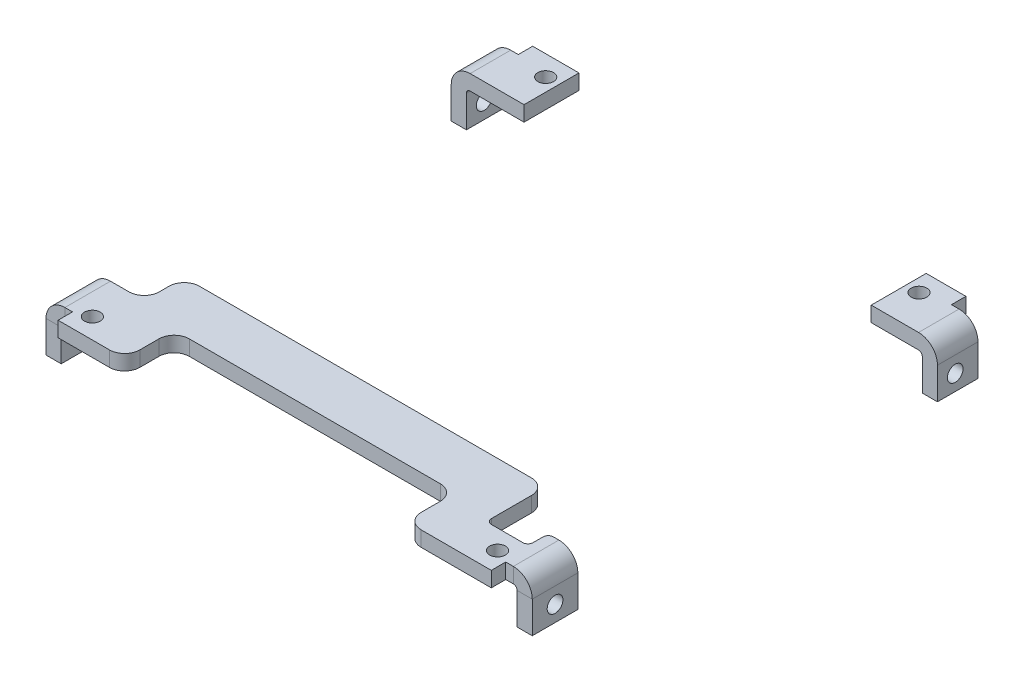
from build123d import *

# Parameters (mm, degrees)
SKETCH2_R                = 1.55
SKETCH2_W                = 53.846
SKETCH2_H                = 54.164
BASE_FLANGE1_DEPTH       = 3
VARFILLET1_START         = -3
VARFILLET1_DEPTH         = 3
VARFILLET2_START         = -3
VARFILLET2_DEPTH         = 3
EDGE_FLANGE1_START       = -44
EDGE_FLANGE1_DEPTH       = 88
EDGE_FLANGE1_START_2     = -45.5
EDGE_FLANGE1_2_OUTLINE_W = 1.2366
EDGE_FLANGE1_2_OUTLINE_H = 3
EDGE_FLANGE1_2_DEPTH     = 1.5
EDGE_FLANGE1_START_3     = 44
EDGE_FLANGE1_3_OUTLINE_W = 1.2366
EDGE_FLANGE1_3_OUTLINE_H = 3
EDGE_FLANGE1_3_DEPTH     = 1.5
EDGE_FLANGE1_4_DEPTH     = 9
EDGE_FLANGE1_START_4     = 35
EDGE_FLANGE1_5_DEPTH     = 9
CUT_EXTRUDE1_DEPTH       = 69.614867264
SKETCH20_R               = 1.55
CUT_EXTRUDE2_DEPTH       = 108.288967324
CUT_EXTRUDE3_DEPTH       = 68.815356
CUT_EXTRUDE3_DEPTH_BACK  = 68.815356
FILLET1_R                = 3
CUT_EXTRUDE4_DEPTH       = 68.815356
SKETCH29_W               = 8.227003602
SKETCH29_H               = 15.176745615
CUT_EXTRUDE5_DEPTH       = 68.815356
FILLET2_R                = 1
FILLET3_R                = 3


with BuildPart() as part:
    # Base-Flange1: sheet metal written as solids
    # Sketch2 → Base-Flange1 (new body)
    with BuildSketch(Plane(origin=(0, 0, 0), x_dir=(1, 0, 0), z_dir=(0, 1, 0))):
        Polygon((-29.625, 48), (-29.625, 37.082), (30.923, 37.082), (30.923, 48), (44, 48), (44, 44), (48, 44), (48, 35), (36.923, 35), (36.923, -35), (48, -35), (48, -44), (44, -44), (44, -48), (30.923, -48), (25.923, -48), (25.923, -37.082), (-29.625, -37.082), (-29.625, -48), (-44, -48), (-44, -44), (-48, -44), (-48, -35), (-37.625, -35), (-37.625, 35), (-48, 35), (-48, 44), (-44, 44), (-44, 48), align=None)
        with Locations(Location((-36.2, 42.85, 0), (0, 0, 270))):
            Circle(SKETCH2_R, mode=Mode.SUBTRACT)
        with Locations(Location((-40, -42.85, 0), (0, 0, 270))):
            Circle(SKETCH2_R, mode=Mode.SUBTRACT)
        with Locations(Location((40, -42.85, 0), (0, 0, 270))):
            Circle(SKETCH2_R, mode=Mode.SUBTRACT)
        with Locations(Location((37.5, 42.85, 0), (0, 0, 270))):
            Circle(SKETCH2_R, mode=Mode.SUBTRACT)
        Rectangle(SKETCH2_W, SKETCH2_H, mode=Mode.SUBTRACT)
    extrude(amount=-BASE_FLANGE1_DEPTH)

    # VarFillet1: read off the stored shape, not the designer's step
    # VarFillet1 outline → VarFillet1 (add)
    with BuildSketch(Plane(origin=(0, 0, 0), x_dir=(1, 0, 0), z_dir=(0, 1, 0)).offset(VARFILLET1_START)):
        with BuildLine():
            Line((30.923, 37.082), (30.923, 40.082))
            add(Edge.make_bspline(
                [(30.923, 40.082), (30.923, 37.082), (27.923, 37.082)],
                knots=[0, 0, 0, 1, 1, 1], degree=2, weights=[1, 0.707106781, 1]))
            Line((27.923, 37.082), (30.923, 37.082))
        make_face()
        with BuildLine():
            Line((36.923, 35), (36.923, 32))
            add(Edge.make_bspline(
                [(36.923, 32), (36.923, 35), (39.923, 35)],
                knots=[0, 0, 0, 1, 1, 1], degree=2, weights=[1, 0.707106781, 1]))
            Line((39.923, 35), (36.923, 35))
        make_face()
        with BuildLine():
            add(Edge.make_bspline(
                [(39.923, -35), (36.923, -35), (36.923, -32)],
                knots=[0, 0, 0, 1, 1, 1], degree=2, weights=[1, 0.707106781, 1]))
            Line((36.923, -32), (36.923, -35))
            Line((36.923, -35), (39.923, -35))
        make_face()
        with BuildLine():
            Line((-29.625, -37.082), (-29.625, -40.082))
            add(Edge.make_bspline(
                [(-29.625, -40.082), (-29.625, -37.082), (-26.625, -37.082)],
                knots=[0, 0, 0, 1, 1, 1], degree=2, weights=[1, 0.707106781, 1]))
            Line((-26.625, -37.082), (-29.625, -37.082))
        make_face()
    extrude(amount=VARFILLET1_DEPTH)

    # VarFillet2: read off the stored shape, not the designer's step
    # VarFillet2 outline → VarFillet2 (add)
    with BuildSketch(Plane(origin=(0, 0, 0), x_dir=(1, 0, 0), z_dir=(0, 1, 0)).offset(VARFILLET2_START)):
        with BuildLine():
            Line((26.923, -27.082), (26.923, -24.082))
            add(Edge.make_bspline(
                [(26.923, -24.082), (26.923, -27.082), (23.923, -27.082)],
                knots=[0, 0, 0, 1, 1, 1], degree=2, weights=[1, 0.707106781, 1]))
            Line((23.923, -27.082), (26.923, -27.082))
        make_face()
        with BuildLine():
            add(Edge.make_bspline(
                [(23.923, 27.082), (26.923, 27.082), (26.923, 24.082)],
                knots=[0, 0, 0, 1, 1, 1], degree=2, weights=[1, 0.707106781, 1]))
            Line((26.923, 24.082), (26.923, 27.082))
            Line((26.923, 27.082), (23.923, 27.082))
        make_face()
        with BuildLine():
            Line((-26.923, -27.082), (-23.923, -27.082))
            add(Edge.make_bspline(
                [(-23.923, -27.082), (-26.923, -27.082), (-26.923, -24.082)],
                knots=[0, 0, 0, 1, 1, 1], degree=2, weights=[1, 0.707106781, 1]))
            Line((-26.923, -24.082), (-26.923, -27.082))
        make_face()
        with BuildLine():
            add(Edge.make_bspline(
                [(-26.923, 24.082), (-26.923, 27.082), (-23.923, 27.082)],
                knots=[0, 0, 0, 1, 1, 1], degree=2, weights=[1, 0.707106781, 1]))
            Line((-23.923, 27.082), (-26.923, 27.082))
            Line((-26.923, 27.082), (-26.923, 24.082))
        make_face()
        with BuildLine():
            Line((-37.625, -35), (-37.625, -32))
            add(Edge.make_bspline(
                [(-37.625, -32), (-37.625, -35), (-40.625, -35)],
                knots=[0, 0, 0, 1, 1, 1], degree=2, weights=[1, 0.707106781, 1]))
            Line((-40.625, -35), (-37.625, -35))
        make_face()
        with BuildLine():
            add(Edge.make_bspline(
                [(-40.625, 35), (-37.625, 35), (-37.625, 32)],
                knots=[0, 0, 0, 1, 1, 1], degree=2, weights=[1, 0.707106781, 1]))
            Line((-37.625, 32), (-37.625, 35))
            Line((-37.625, 35), (-40.625, 35))
        make_face()
        with BuildLine():
            Line((-29.625, 37.082), (-26.625, 37.082))
            add(Edge.make_bspline(
                [(-26.625, 37.082), (-29.625, 37.082), (-29.625, 40.082)],
                knots=[0, 0, 0, 1, 1, 1], degree=2, weights=[1, 0.707106781, 1]))
            Line((-29.625, 40.082), (-29.625, 37.082))
        make_face()
    extrude(amount=VARFILLET2_DEPTH)

    # Edge-Flange1: read off the stored shape, not the designer's step
    # Edge-Flange1 outline → Edge-Flange1 (cut)
    with BuildSketch(Plane.XY.offset(EDGE_FLANGE1_START)):
        with BuildLine():
            ThreePointArc((-47.926677222, -3), (-46.630867001, -0.845704021), (-44.2634, 0))
            Line((-44.2634, 0), (-48, 0))
            Line((-48, 0), (-48, -3))
            Line((-48, -3), (-47.926677222, -3))
        make_face()
        with BuildLine():
            Line((48, 0), (44.2634, 0))
            ThreePointArc((44.2634, 0), (46.630867001, -0.845704021), (47.926677222, -3))
            Line((47.926677222, -3), (48, -3))
            Line((48, -3), (48, 0))
        make_face()
    extrude(amount=EDGE_FLANGE1_DEPTH, mode=Mode.SUBTRACT)

    # Edge-Flange1 2 outline → Edge-Flange1 2 (cut)
    with BuildSketch(Plane.XY.offset(EDGE_FLANGE1_START_2)):
        with Locations((-43.3817, -1.5)):
            Rectangle(EDGE_FLANGE1_2_OUTLINE_W, EDGE_FLANGE1_2_OUTLINE_H)
        with Locations((43.3817, -1.5)):
            Rectangle(EDGE_FLANGE1_2_OUTLINE_W, EDGE_FLANGE1_2_OUTLINE_H)
    extrude(amount=EDGE_FLANGE1_2_DEPTH, mode=Mode.SUBTRACT)

    # Edge-Flange1 3 outline → Edge-Flange1 3 (cut)
    with BuildSketch(Plane.XY.offset(EDGE_FLANGE1_START_3)):
        with Locations((-43.3817, -1.5)):
            Rectangle(EDGE_FLANGE1_3_OUTLINE_W, EDGE_FLANGE1_3_OUTLINE_H)
        with Locations((43.3817, -1.5)):
            Rectangle(EDGE_FLANGE1_3_OUTLINE_W, EDGE_FLANGE1_3_OUTLINE_H)
    extrude(amount=EDGE_FLANGE1_3_DEPTH, mode=Mode.SUBTRACT)

    # Edge-Flange1 4 outline → Edge-Flange1 4 (add)
    with BuildSketch(Plane.XY.offset(EDGE_FLANGE1_START)):
        with BuildLine():
            ThreePointArc((-45, -3.7366), (-44.784254855, -3.215745145), (-44.2634, -3))
            Line((-44.2634, -3), (-47.926677222, -3))
            ThreePointArc((-47.926677222, -3), (-47.981624121, -3.36647982), (-48, -3.7366))
            Line((-48, -3.7366), (-48, -10))
            Line((-48, -10), (-45, -10))
            Line((-45, -10), (-45, -3.7366))
        make_face()
        with BuildLine():
            Line((47.926677222, -3), (44.2634, -3))
            ThreePointArc((44.2634, -3), (44.784254855, -3.215745145), (45, -3.7366))
            Line((45, -3.7366), (45, -10))
            Line((45, -10), (48, -10))
            Line((48, -10), (48, -3.7366))
            ThreePointArc((48, -3.7366), (47.981624121, -3.36647982), (47.926677222, -3))
        make_face()
    extrude(amount=EDGE_FLANGE1_4_DEPTH)

    # Edge-Flange1 5 outline → Edge-Flange1 5 (add)
    with BuildSketch(Plane.XY.offset(EDGE_FLANGE1_START_4)):
        with BuildLine():
            ThreePointArc((-45, -3.7366), (-44.784254855, -3.215745145), (-44.2634, -3))
            Line((-44.2634, -3), (-47.926677222, -3))
            ThreePointArc((-47.926677222, -3), (-47.981624121, -3.36647982), (-48, -3.7366))
            Line((-48, -3.7366), (-48, -10))
            Line((-48, -10), (-45, -10))
            Line((-45, -10), (-45, -3.7366))
        make_face()
        with BuildLine():
            Line((47.926677222, -3), (44.2634, -3))
            ThreePointArc((44.2634, -3), (44.784254855, -3.215745145), (45, -3.7366))
            Line((45, -3.7366), (45, -10))
            Line((45, -10), (48, -10))
            Line((48, -10), (48, -3.7366))
            ThreePointArc((48, -3.7366), (47.981624121, -3.36647982), (47.926677222, -3))
        make_face()
    extrude(amount=EDGE_FLANGE1_5_DEPTH)

    # Sketch19 → Cut-Extrude1 (cut, through all)
    with BuildSketch(Plane(origin=(0, 0, 0), x_dir=(1, 0, 0), z_dir=(0, 1, 0))):
        Polygon((-42.7634, 45.5), (-42.7634, 46.85), (-29.625, 46.85), (-29.625, 48), (-44, 48), (-44, 45.5), align=None)
        Polygon((44, 45.5), (42.7634, 45.5), (42.7634, 46.85), (29.625, 46.85), (29.625, 48), (44, 48), align=None)
        Polygon((42.7634, -45.5), (42.7634, -46.85), (24.798845721, -46.85), (24.798845721, -48), (44, -48), (44, -45.5), align=None)
        Polygon((-44, -45.5), (-42.7634, -45.5), (-42.7634, -46.85), (-29.625, -46.85), (-29.625, -48), (-44, -48), align=None)
    extrude(amount=-CUT_EXTRUDE1_DEPTH, mode=Mode.SUBTRACT)

    # Sketch20 → Cut-Extrude2 (cut, through all)
    with BuildSketch(Plane.ZY.offset(48)):
        with Locations(Location((-39.5, -6.8683, 0), (0, 0, 270))):
            Circle(SKETCH20_R)
        with Locations(Location((39.5, -6.8683, 0), (0, 0, 270))):
            Circle(SKETCH20_R)
    extrude(amount=-CUT_EXTRUDE2_DEPTH, mode=Mode.SUBTRACT)

    # Sketch21 → Cut-Extrude3 (cut, two sides: drawn at the far end of the back side and taken through both)
    with BuildSketch(Plane(origin=(0, 0, 0), x_dir=(1, 0, 0), z_dir=(0, 1, 0)).offset(-CUT_EXTRUDE3_DEPTH_BACK)):
        Polygon((36.923, -27.082), (-37.625, -27.082), (-71.217622097, -27.082), (-71.217622097, 35), (-32.625, 35), (-32.625, 50), (33.923, 50), (33.923, 35), (65.560700491, 35), (65.560700491, -21.509199751), align=None)
    extrude(amount=CUT_EXTRUDE3_DEPTH + CUT_EXTRUDE3_DEPTH_BACK, mode=Mode.SUBTRACT)


with BuildPart() as cut_extrude3_piece_1:
    # of the separate pieces the step leaves, piece 1, a body of its own (cut_extrude3_pieces)
    add(part.part.solids().sort_by_distance((-37.625, 0, 32))[0])

    # Fillet1
    fillet1_edges = [cut_extrude3_piece_1.edges().sort_by_distance(p)[0] for p in [
        (36.923, -1.5, 27.082),
        (-37.625, -1.5, 27.082),
        (-29.625, -1.5, 46.85),
    ]]
    fillet(fillet1_edges, radius=FILLET1_R)

    # Sketch29 → Cut-Extrude5 (cut, through all)
    with BuildSketch(Plane(origin=(0, 0, 0), x_dir=(1, 0, 0), z_dir=(0, 1, 0))):
        with Locations((38.036501801, -31.411627192)):
            Rectangle(SKETCH29_W, SKETCH29_H)
    extrude(amount=-CUT_EXTRUDE5_DEPTH, mode=Mode.SUBTRACT)

    # Fillet2
    fillet2_edges = [cut_extrude3_piece_1.edges().sort_by_distance(p)[0] for p in [
        (42.150003602, -1.5, 35),
        (33.923, -1.5, 39),
        (42.150003602, -1.5, 39),
    ]]
    fillet(fillet2_edges, radius=FILLET2_R)

    # Fillet3
    fillet3_edges = [cut_extrude3_piece_1.edges().sort_by_distance(p)[0] for p in [
        (25.923, -1.5, 46.85),
        (33.923, -1.5, 27.082),
        (25.923, -1.5, 37.082),
    ]]
    fillet(fillet3_edges, radius=FILLET3_R)


with BuildPart() as cut_extrude3_piece_2:
    # of the separate pieces the step leaves, piece 2, a body of its own (cut_extrude3_pieces)
    add(part.part.solids().sort_by_distance((-42.7634, 0, -44))[0])


with BuildPart() as cut_extrude3_piece_3:
    # of the separate pieces the step leaves, piece 3, a body of its own (cut_extrude3_pieces)
    add(part.part.solids().sort_by_distance((33.923, 0, -46.85))[0])


with BuildPart() as cut_extrude4_tool:
    # Sketch28 → Cut-Extrude4 (new, through all)
    with BuildSketch(Plane(origin=(0, 0, 0), x_dir=(1, 0, 0), z_dir=(0, 1, 0))):
        Polygon((-44.2634, 36), (-33.625, 36), (-33.625, 46.85), (-33.625, 50.132362052), (34.923, 50.132362052), (34.923, 46.85), (34.923, 36), (44.2634, 36), (57.549667037, 36), (57.549667037, 25.658972996), (-51.756960045, 25.658972996), (-51.756960045, 36), align=None)
    extrude(amount=-CUT_EXTRUDE4_DEPTH)


with BuildPart() as cut_extrude3_piece_2_1:
    add(cut_extrude3_piece_2.part)

    # Cut-Extrude4: cut by cut_extrude4_tool
    add(cut_extrude4_tool.part, mode=Mode.SUBTRACT)


with BuildPart() as cut_extrude3_piece_3_1:
    add(cut_extrude3_piece_3.part)

    # Cut-Extrude4: cut by cut_extrude4_tool
    add(cut_extrude4_tool.part, mode=Mode.SUBTRACT)


solid = Compound([cut_extrude3_piece_1.part, cut_extrude3_piece_2_1.part, cut_extrude3_piece_3_1.part])
